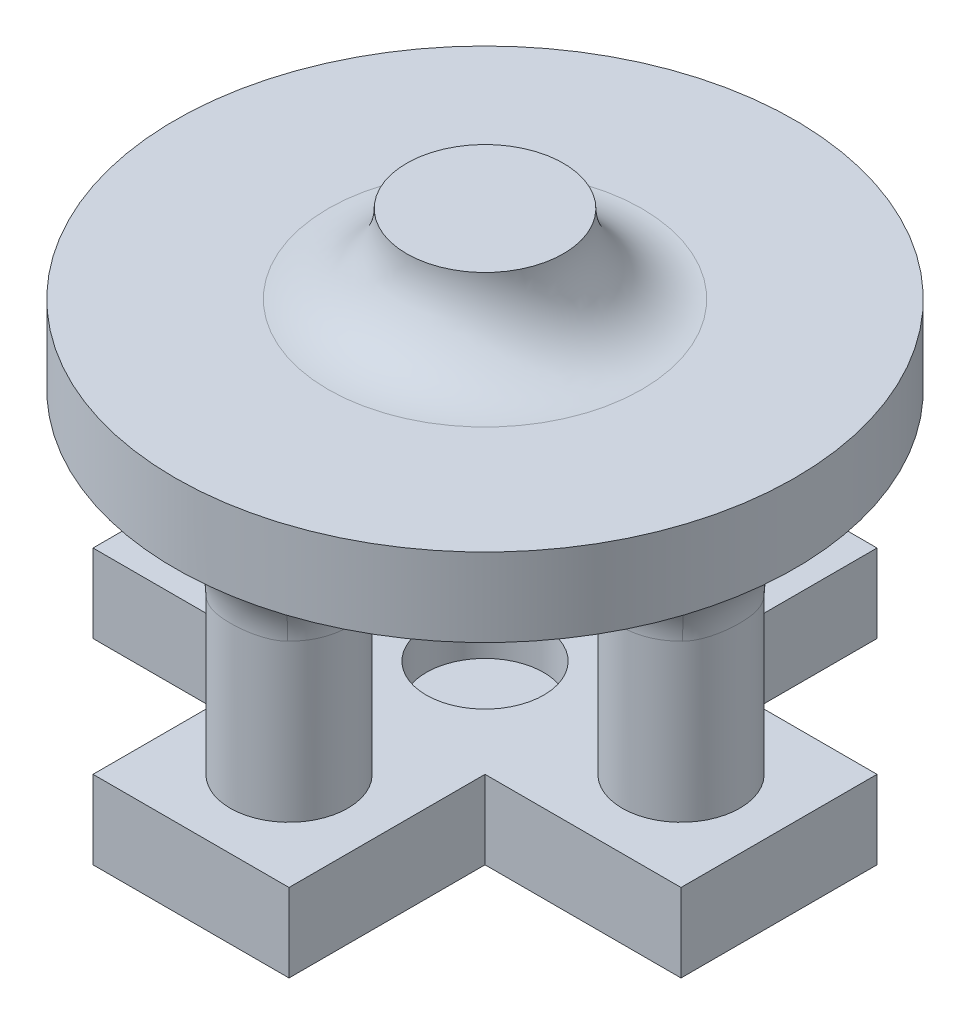
from build123d import *

# Parameters (mm, degrees)
BODY_DEPTH        = 2.54
SKETCH2_R         = 1.905
LEGS_DEPTH        = 7.62
SKETCH4_R         = 1.905
SPRING_HOLE_DEPTH = 1.27
SKETCH5_R         = 10.040231571
FOOT_DEPTH        = 2.54
SKETCH6_R         = 2.54
FLAG_DEPTH        = 2.54
ROUNDITY_R        = 2.54


with BuildPart() as part:
    # Sketch1 → body (new body)
    with BuildSketch(Plane(origin=(0, 0, 0), x_dir=(1, 0, 0), z_dir=(0, 1, 0))):
        Polygon((-8.348684361, -10.452067183), (-8.348684361, -4.102067183), (-1.998684361, -4.102067183), (-1.998684361, -10.452067183), (4.351315639, -10.452067183), (4.351315639, -16.802067183), (-1.998684361, -16.802067183), (-1.998684361, -23.152067183), (-8.348684361, -23.152067183), (-8.348684361, -16.802067183), (-14.698684361, -16.802067183), (-14.698684361, -10.452067183), align=None)
    extrude(amount=BODY_DEPTH)

    # Sketch2 → legs (add)
    with BuildSketch(Plane(origin=(0, 2.54, 0), x_dir=(1, 0, 0), z_dir=(0, 1, 0))):
        with Locations(Location((-5.173684361, -7.277067183, 0), (0, 0, 90))):
            Circle(SKETCH2_R)
        with Locations(Location((1.176315639, -13.627067183, 0), (0, 0, 90))):
            Circle(SKETCH2_R)
        with Locations(Location((-5.173684361, -19.977067183, 0), (0, 0, 90))):
            Circle(SKETCH2_R)
        with Locations(Location((-11.523684361, -13.627067183, 0), (0, 0, 90))):
            Circle(SKETCH2_R)
    extrude(amount=LEGS_DEPTH)

    # Sketch4 → spring hole (cut)
    with BuildSketch(Plane(origin=(0, 2.54, 0), x_dir=(1, 0, 0), z_dir=(0, 1, 0))):
        with Locations(Location((-5.173684361, -13.627067183, 0), (0, 0, 270))):
            Circle(SKETCH4_R)
    extrude(amount=-SPRING_HOLE_DEPTH, mode=Mode.SUBTRACT)

    # Sketch5 → foot (add)
    with BuildSketch(Plane(origin=(0, 10.16, 0), x_dir=(1, 0, 0), z_dir=(0, 1, 0))):
        with Locations(Location((-5.173684361, -13.627067183, 0), (0, 0, 270))):
            Circle(SKETCH5_R)
    extrude(amount=FOOT_DEPTH)

    # Sketch6 → flag (add)
    with BuildSketch(Plane(origin=(0, 12.7, 0), x_dir=(1, 0, 0), z_dir=(0, 1, 0))):
        with Locations(Location((-5.173684361, -13.627067183, 0), (0, 0, 270))):
            Circle(SKETCH6_R)
    extrude(amount=FLAG_DEPTH)

    # roundity
    roundity_edges = [part.edges().sort_by_distance(p)[0] for p in [
        (-5.173684361, 10.16, 9.182067183),
        (1.176315639, 10.16, 15.532067183),
        (-5.173684361, 10.16, 21.882067183),
        (-11.523684361, 10.16, 15.532067183),
        (-5.173684361, 12.7, 11.087067183),
    ]]
    fillet(roundity_edges, radius=ROUNDITY_R - 0.0001)  # a hair under: the kernel refuses the full size


solid = part.part
